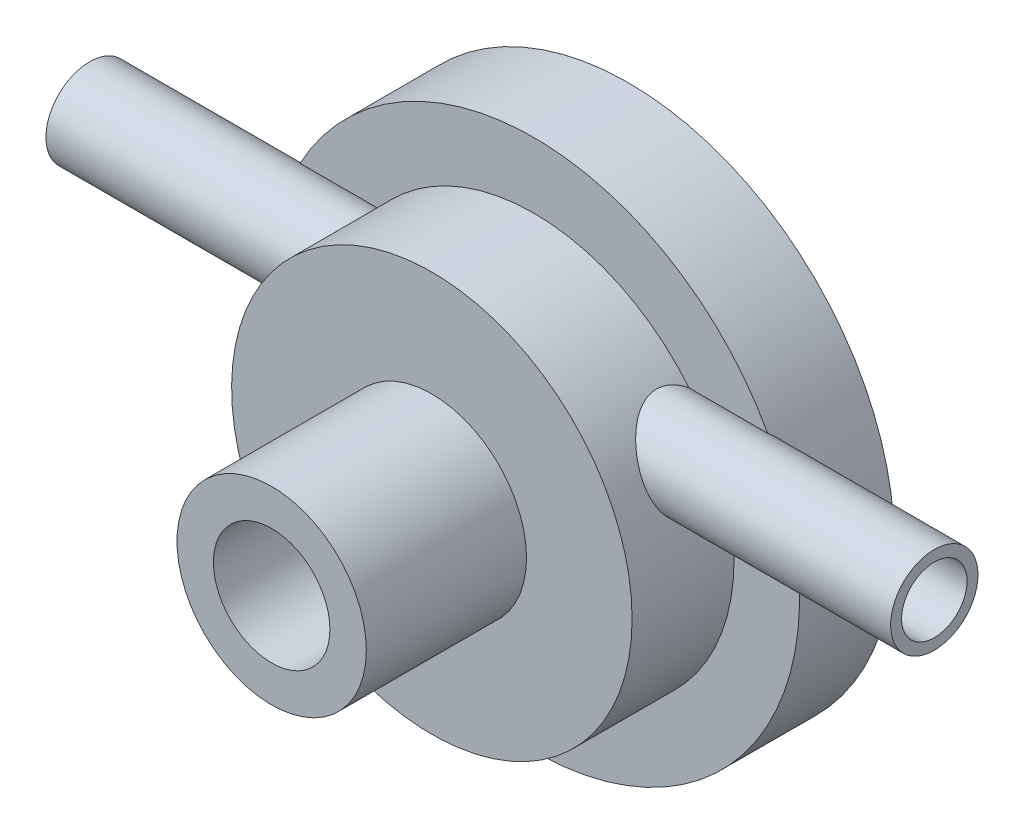
from build123d import *

# Parameters (mm, degrees)
SKETCH1_R                = 36.5
BOSS_EXTRUDE1_DEPTH      = 13
SKETCH2_R                = 27.5
BOSS_EXTRUDE2_DEPTH      = 14
SKETCH3_R                = 13
BOSS_EXTRUDE3_DEPTH      = 22
SKETCH4_R                = 8
CUT_EXTRUDE1_DEPTH       = 72.172326083
BOSS_EXTRUDE4_DEPTH      = 22
BOSS_EXTRUDE4_DEPTH_BACK = 94
SKETCH6_R                = 6
CUT_EXTRUDE2_DEPTH       = 13
SKETCH10_R               = 4.5
CUT_EXTRUDE3_DEPTH       = 132.107780243


with BuildPart() as part:
    # Sketch1 → Boss-Extrude1 (new body)
    with BuildSketch(Plane.XY):
        Circle(SKETCH1_R)
    extrude(amount=BOSS_EXTRUDE1_DEPTH)

    # Sketch2 → Boss-Extrude2 (add)
    with BuildSketch(Plane.XY.offset(13)):
        Circle(SKETCH2_R)
    extrude(amount=BOSS_EXTRUDE2_DEPTH)

    # Sketch3 → Boss-Extrude3 (add)
    with BuildSketch(Plane.XY.offset(27)):
        Circle(SKETCH3_R)
    extrude(amount=BOSS_EXTRUDE3_DEPTH)

    # Sketch4 → Cut-Extrude1 (cut, through all)
    with BuildSketch(Plane.XY.offset(49)):
        Circle(SKETCH4_R)
    extrude(amount=-CUT_EXTRUDE1_DEPTH, mode=Mode.SUBTRACT)

    # Sketch6 → Boss-Extrude4 (add, two sides: drawn at the far end of the back side and taken through both)
    with BuildSketch(Plane(origin=(36.5, 0, 0), x_dir=(0, 0, -1), z_dir=(1, 0, 0)).offset(-BOSS_EXTRUDE4_DEPTH_BACK)):
        with Locations((-16.5, 12.5)):
            Circle(SKETCH6_R)
    extrude(amount=BOSS_EXTRUDE4_DEPTH + BOSS_EXTRUDE4_DEPTH_BACK)

    # Sketch8 → Cut-Extrude2 (cut)
    with BuildSketch(Plane(origin=(0, 0, 0), x_dir=(-1, 0, 0), z_dir=(0, 0, -1))):
        with BuildLine():
            ThreePointArc((-18.104615423, 13.359375), (0, -22.5), (18.104615423, 13.359375))
            ThreePointArc((18.104615423, 13.359375), (0, 20), (-18.104615423, 13.359375))
        make_face()
    extrude(amount=-CUT_EXTRUDE2_DEPTH, mode=Mode.SUBTRACT)

    # Sketch10 → Cut-Extrude3 (cut, through all)
    with BuildSketch(Plane(origin=(58.5, 0, 0), x_dir=(0, 0, -1), z_dir=(1, 0, 0))):
        with Locations((-16.5, 12.5)):
            Circle(SKETCH10_R)
    extrude(amount=-CUT_EXTRUDE3_DEPTH, mode=Mode.SUBTRACT)


solid = part.part
